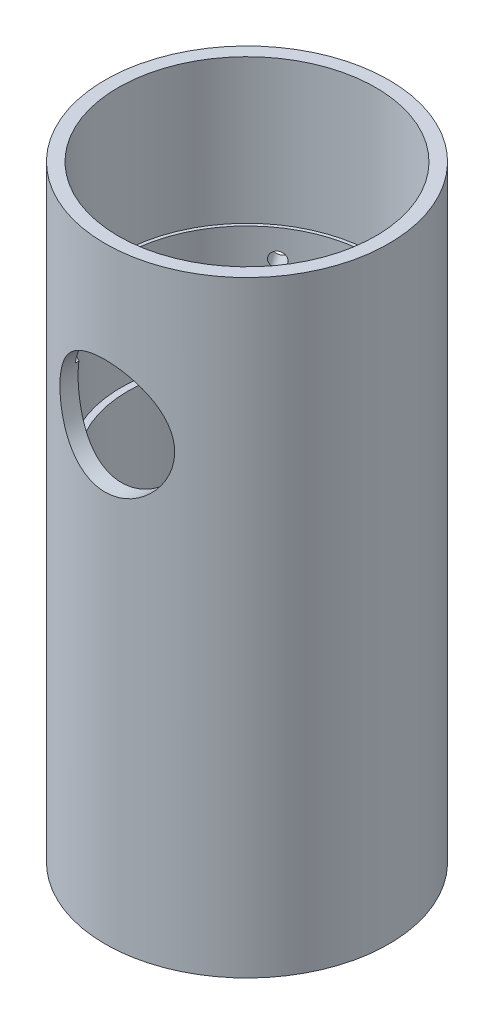
from build123d import *

# Parameters (mm, degrees)
SKETCH1_R           = 43.25
SKETCH1_R_2         = 38.25
BOSS_EXTRUDE1_DEPTH = 92.5
BOSS_EXTRUDE2_START = -6.35
SKETCH2_R           = 38.25
SKETCH2_R_2         = 36.25
BOSS_EXTRUDE2_DEPTH = 100
CUT_EXTRUDE3_START  = -44
SKETCH6_R           = 39.25
SKETCH6_R_2         = 38.25
CUT_EXTRUDE3_DEPTH  = 44
SKETCH8_R           = 17.5
CUT_EXTRUDE5_DEPTH  = 111.893530019
SKETCH11_R          = 2.25
CUT_EXTRUDE6_DEPTH  = 111.89353018


with BuildPart() as part:
    # Sketch1 → Boss-Extrude1 (new, symmetric)
    with BuildSketch(Plane(origin=(0, 0, 0), x_dir=(1, 0, 0), z_dir=(0, 1, 0))):
        Circle(SKETCH1_R)
        Circle(SKETCH1_R_2, mode=Mode.SUBTRACT)
    extrude(amount=BOSS_EXTRUDE1_DEPTH, both=True)

    # Sketch2 → Boss-Extrude2 (add)
    with BuildSketch(Plane.XZ.offset(92.5).offset(BOSS_EXTRUDE2_START)):
        Circle(SKETCH2_R)
        Circle(SKETCH2_R_2, mode=Mode.SUBTRACT)
    extrude(amount=-BOSS_EXTRUDE2_DEPTH)

    # Sketch6 → Cut-Extrude3 (cut)
    with BuildSketch(Plane(origin=(0, 92.5, 0), x_dir=(1, 0, 0), z_dir=(0, 1, 0)).offset(CUT_EXTRUDE3_START)):
        Circle(SKETCH6_R)
        Circle(SKETCH6_R_2, mode=Mode.SUBTRACT)
    extrude(amount=CUT_EXTRUDE3_DEPTH, mode=Mode.SUBTRACT)

    # Sketch8 → Cut-Extrude5 (cut, through all)
    with BuildSketch(Plane.XY):
        with Locations((0, 44.35)):
            Circle(SKETCH8_R)
    extrude(amount=CUT_EXTRUDE5_DEPTH, mode=Mode.SUBTRACT)

    # Sketch11 → Cut-Extrude6 (cut, through all)
    with BuildSketch(Plane(origin=(0, 0, 0), x_dir=(-0.8191520442889909, 0, 0.5735764363510475), z_dir=(-0.5735764363510475, 0, -0.8191520442889909))):
        with Locations((0, -40)):
            Circle(SKETCH11_R)
        with Locations((0, 40)):
            Circle(SKETCH11_R)
    cut_extrude6 = extrude(amount=CUT_EXTRUDE6_DEPTH, mode=Mode.SUBTRACT)

    # Mirror1: Cut-Extrude6 across plane
    add(cut_extrude6.mirror(Plane(origin=(0, 0, 0), x_dir=(0, 0, 1), z_dir=(1, 0, 0))), mode=Mode.SUBTRACT)


solid = part.part
